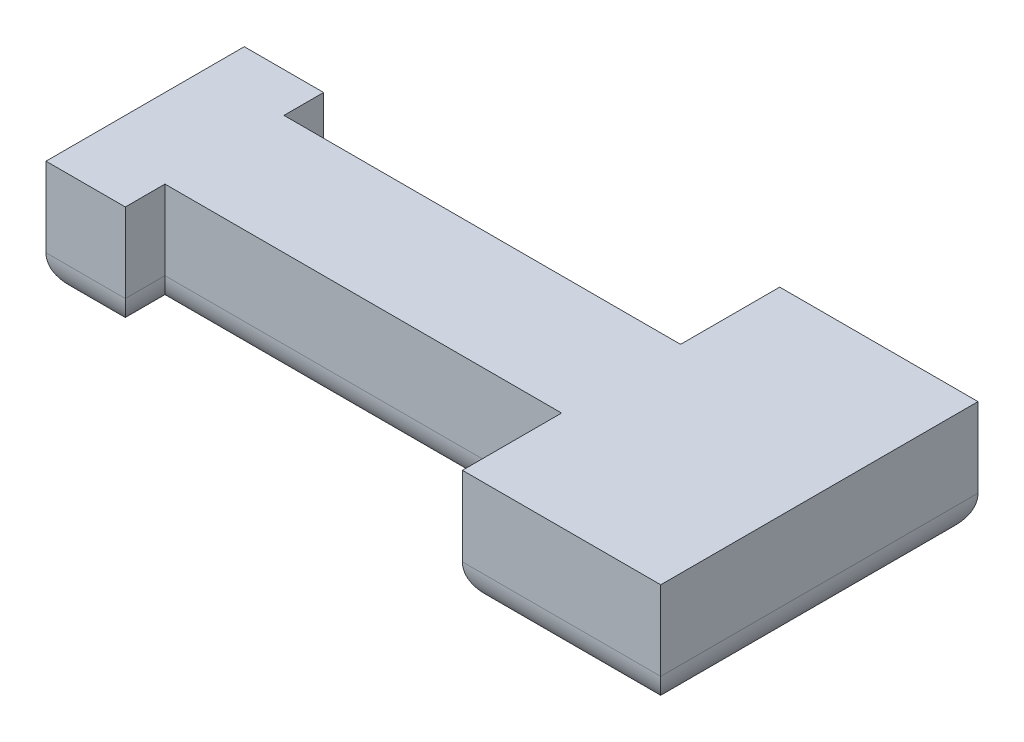
from build123d import *

# Parameters (mm, degrees)
BOSS_EXTRUDE1_DEPTH = 3
FILLET2_R           = 1


with BuildPart() as part:
    # Sketch1 → Boss-Extrude1 (new body)
    with BuildSketch(Plane(origin=(0, 0, 0), x_dir=(1, 0, 0), z_dir=(0, 1, 0))):
        Polygon((-12.5, -1.5), (-12.5, -2.5), (-14.5, -2.5), (-14.5, 2.5), (-12.5, 2.5), (-12.5, 1.5), (-2.5, 1.5), (-2.5, 4), (2.5, 4), (2.5, -4), (-2.5, -4), (-2.5, -1.5), align=None)
    extrude(amount=BOSS_EXTRUDE1_DEPTH)

    # Fillet2
    fillet2_edges = [part.edges().sort_by_distance(p)[0] for p in [
        (0, 0, 4),
        (-2.5, 0, 2.75),
        (-7.5, 0, 1.5),
        (-12.5, 0, 2),
        (-13.5, 0, 2.5),
        (-14.5, 0, 0),
        (-13.5, 0, -2.5),
        (-12.5, 0, -2),
        (-7.5, 0, -1.5),
        (-2.5, 0, -2.75),
        (0, 0, -4),
        (2.5, 0, 0),
    ]]
    fillet(fillet2_edges, radius=FILLET2_R - 0.0001)  # a hair under: the kernel refuses the full size


solid = part.part
